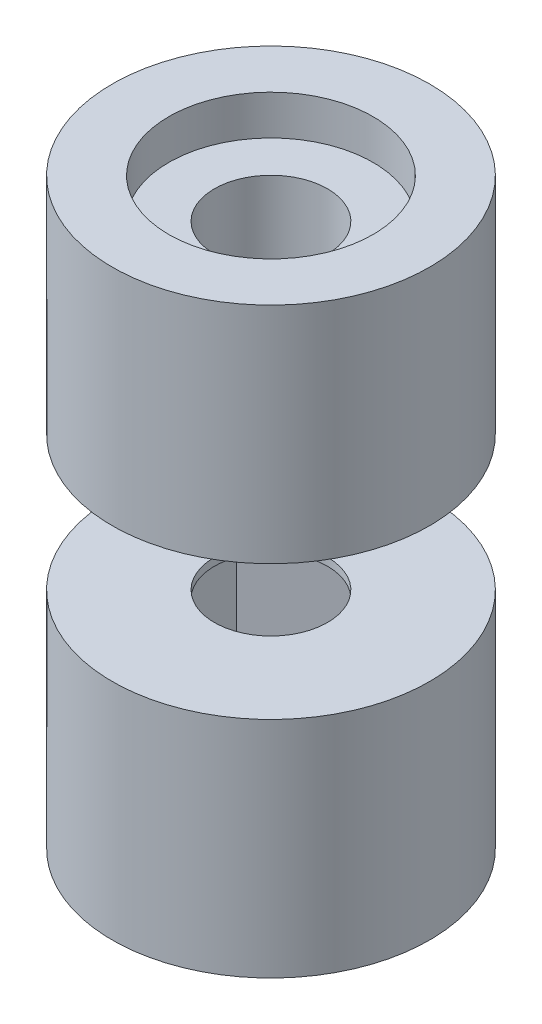
from build123d import *

# Parameters (mm, degrees)
SKETCH1_R               = 8
BOSS_EXTRUDE1_DEPTH     = 29.381
CUT_EXTRUDE1_DEPTH      = 32.484014372
CUT_EXTRUDE1_DEPTH_BACK = 32.484014372
SKETCH2_W               = 20.4
SKETCH2_H               = 6.8
SKETCH3_R               = 2.85
CUT_EXTRUDE2_DEPTH      = 29.381
SKETCH4_R               = 5.15
CUT_EXTRUDE3_DEPTH      = 2
CUT_EXTRUDE4_DEPTH      = 10.9


with BuildPart() as part:
    # Sketch1 → Boss-Extrude1 (new body)
    with BuildSketch(Plane(origin=(0, 0, 0), x_dir=(1, 0, 0), z_dir=(0, 1, 0))):
        Circle(SKETCH1_R)
    extrude(amount=BOSS_EXTRUDE1_DEPTH)

    # Sketch2 → Cut-Extrude1 (cut, two sides: drawn at the far end of the back side and taken through both)
    with BuildSketch(Plane.XY.offset(-CUT_EXTRUDE1_DEPTH_BACK)):
        with Locations((0, 14.69)):
            Rectangle(SKETCH2_W, SKETCH2_H)
    extrude(amount=CUT_EXTRUDE1_DEPTH + CUT_EXTRUDE1_DEPTH_BACK, mode=Mode.SUBTRACT)


with BuildPart() as cut_extrude1_piece_1:
    # of the separate pieces the step leaves, piece 1, a body of its own (cut_extrude1_pieces)
    add(part.part.solids().sort_by_distance((8, 18.09, 0))[0])


with BuildPart() as cut_extrude1_piece_2:
    # of the separate pieces the step leaves, piece 2, a body of its own (cut_extrude1_pieces)
    add(part.part.solids().sort_by_distance((8, 0, 0))[0])


with BuildPart() as cut_extrude2_tool:
    # Sketch3 → Cut-Extrude2 (new body)
    with BuildSketch(Plane(origin=(0, 0, 0), x_dir=(1, 0, 0), z_dir=(0, 1, 0))):
        Circle(SKETCH3_R)
    extrude(amount=CUT_EXTRUDE2_DEPTH)


with BuildPart() as cut_extrude1_piece_1_1:
    add(cut_extrude1_piece_1.part)

    # Cut-Extrude2: cut by cut_extrude2_tool
    add(cut_extrude2_tool.part, mode=Mode.SUBTRACT)

    # Sketch4 → Cut-Extrude3 (cut)
    with BuildSketch(Plane(origin=(0, 29.381, 0), x_dir=(1, 0, 0), z_dir=(0, 1, 0))):
        Circle(SKETCH4_R)
    extrude(amount=-CUT_EXTRUDE3_DEPTH, mode=Mode.SUBTRACT)


with BuildPart() as cut_extrude1_piece_2_1:
    add(cut_extrude1_piece_2.part)

    # Cut-Extrude2: cut by cut_extrude2_tool
    add(cut_extrude2_tool.part, mode=Mode.SUBTRACT)

    # Sketch5 → Cut-Extrude4 (cut)
    with BuildSketch(Plane(origin=(0, 0, 0), x_dir=(1, 0, 0), z_dir=(0, 1, 0))):
        Polygon((4.1, -2.367136104), (0, -4.734272207), (-4.1, -2.367136104), (-4.1, 2.367136104), (0, 4.734272207), (4.1, 2.367136104), align=None)
    extrude(amount=CUT_EXTRUDE4_DEPTH, mode=Mode.SUBTRACT)


solid = Compound([cut_extrude1_piece_1_1.part, cut_extrude1_piece_2_1.part])
